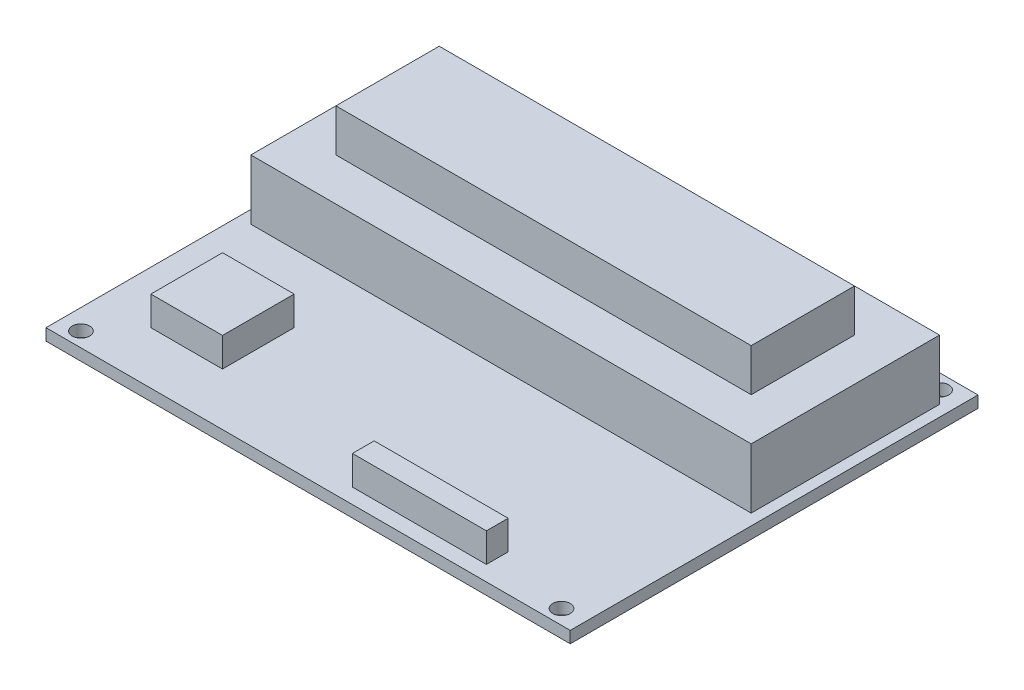
from build123d import *

# Parameters (mm, degrees)
SKETCH1_W           = 90
SKETCH1_H           = 70
BOSS_EXTRUDE1_DEPTH = 2
SKETCH2_R           = 1.5
CUT_EXTRUDE1_DEPTH  = 58.043842788
SKETCH3_W           = 23
SKETCH3_H           = 3.733741838
SKETCH3_W_2         = 12.3
SKETCH3_H_2         = 12.3
BOSS_EXTRUDE2_DEPTH = 5
SKETCH4_W           = 71.3
SKETCH4_H           = 17.735180651
BOSS_EXTRUDE3_DEPTH = 17.6
SKETCH5_W           = 85.9
SKETCH5_H           = 32.335180651
BOSS_EXTRUDE4_DEPTH = 10.3


with BuildPart() as part:
    # Sketch1 → Boss-Extrude1 (new body)
    with BuildSketch(Plane(origin=(0, 0, 0), x_dir=(1, 0, 0), z_dir=(0, 1, 0))):
        Rectangle(SKETCH1_W, SKETCH1_H)
    extrude(amount=BOSS_EXTRUDE1_DEPTH)

    # Sketch2 → Cut-Extrude1 (cut, through all)
    with BuildSketch(Plane(origin=(0, 2, 0), x_dir=(1, 0, 0), z_dir=(0, 1, 0))):
        with Locations((-41.5, 32.5)):
            Circle(SKETCH2_R)
        with Locations((-41.5, -32.5)):
            Circle(SKETCH2_R)
        with Locations((41, -32.5)):
            Circle(SKETCH2_R)
        with Locations((41, 32.5)):
            Circle(SKETCH2_R)
    extrude(amount=-CUT_EXTRUDE1_DEPTH, mode=Mode.SUBTRACT)

    # Sketch3 → Boss-Extrude2 (add)
    with BuildSketch(Plane(origin=(0, 2, 0), x_dir=(1, 0, 0), z_dir=(0, 1, 0))):
        with Locations((16.5, -30.528214904)):
            Rectangle(SKETCH3_W, SKETCH3_H)
        with Locations((-29.85, -19.85)):
            Rectangle(SKETCH3_W_2, SKETCH3_H_2)
    extrude(amount=BOSS_EXTRUDE2_DEPTH)

    # Sketch4 → Boss-Extrude3 (add)
    with BuildSketch(Plane(origin=(0, 2, 0), x_dir=(1, 0, 0), z_dir=(0, 1, 0))):
        with Locations((0.15, 14.132409674)):
            Rectangle(SKETCH4_W, SKETCH4_H)
    extrude(amount=BOSS_EXTRUDE3_DEPTH)

    # Sketch5 → Boss-Extrude4 (add)
    with BuildSketch(Plane(origin=(0, 2, 0), x_dir=(1, 0, 0), z_dir=(0, 1, 0))):
        with Locations((0.15, 14.132409674)):
            Rectangle(SKETCH5_W, SKETCH5_H)
    extrude(amount=BOSS_EXTRUDE4_DEPTH)


solid = part.part
